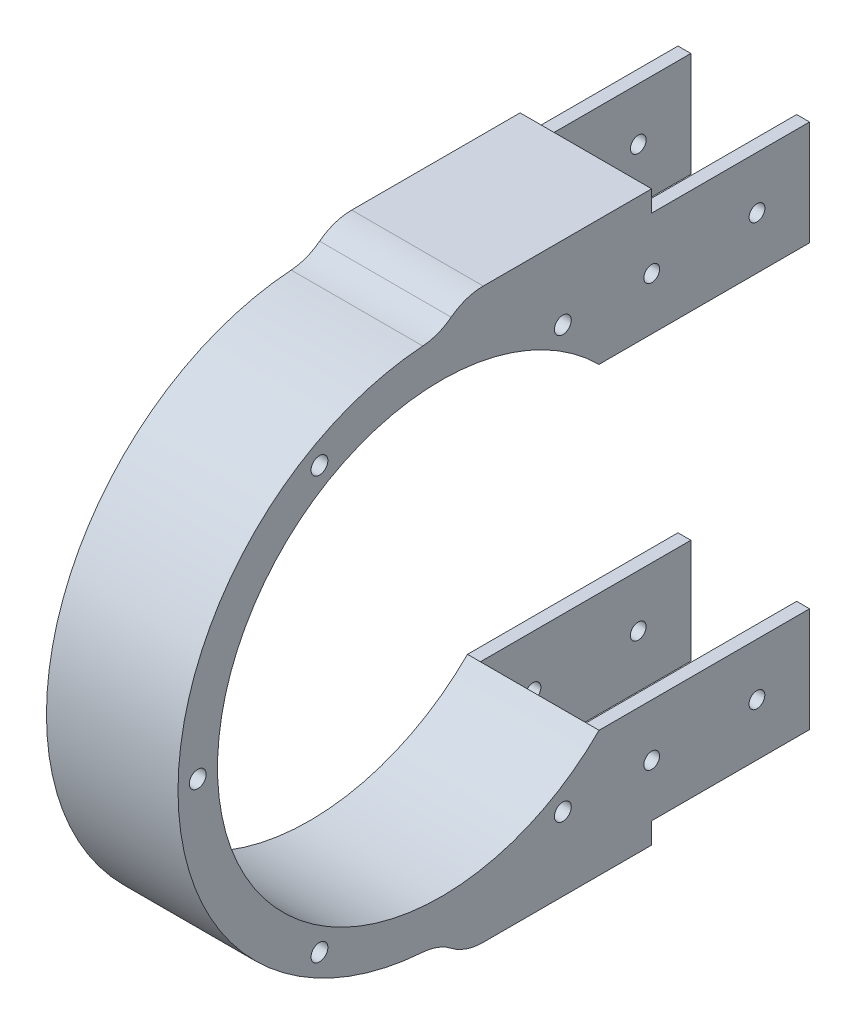
from build123d import *

# Parameters (mm, degrees)
SKETCH_1_R          = 1.6
EXTRUDE_1_DEPTH     = 25
SKETCH_2_W          = 2.45
SKETCH_2_H          = 19.896013553
EXTRUDE_2_DEPTH     = 40
SKETCH_3_R          = 1.5
CUT_EXTRUDE_1_DEPTH = 90.582364336
SKETCH_4_W          = 40
SKETCH_4_H          = 4
EXTRUDE_3_DEPTH     = 25
FILLET_4_R          = 10
FILLET_5_R          = 10


with BuildPart() as part:
    # 草图1 → 凸台-拉伸1 (new body)
    # profile 1 of 2: a face of its own
    with BuildSketch(Plane(origin=(0, 0, 0), x_dir=(0, 0, -1), z_dir=(1, 0, 0))):
        with BuildLine():
            ThreePointArc((-47.85, 0), (-46.25, 1.6), (-44.65, 0))
            Line((-44.65, 0), (-42.5, 0))
            ThreePointArc((-42.5, 0), (-16.298006013, 39.25079617), (30, 30.103986447))
            Line((30, 30.103986447), (30, 50))
            Line((30, 50), (0, 50))
            ThreePointArc((0, 50), (-35.355339059, 35.355339059), (-50, 0))
            Line((-50, 0), (-47.85, 0))
        make_face()
        with Locations((-23.125, 40.053674925)):
            Circle(SKETCH_1_R, mode=Mode.SUBTRACT)
        with Locations((23.125, 40.053674925)):
            Circle(SKETCH_1_R, mode=Mode.SUBTRACT)
    # profile 2 of 2: a face of its own
    with BuildSketch(Plane(origin=(0, 0, 0), x_dir=(0, 0, -1), z_dir=(1, 0, 0))):
        with BuildLine():
            Line((-42.5, 0), (-44.65, 0))
            ThreePointArc((-44.65, 0), (-46.25, -1.6), (-47.85, 0))
            Line((-47.85, 0), (-50, 0))
            ThreePointArc((-50, 0), (-35.355339059, -35.355339059), (0, -50))
            Line((0, -50), (30, -50))
            Line((30, -50), (30, -30.103986447))
            ThreePointArc((30, -30.103986447), (-16.298006013, -39.25079617), (-42.5, 0))
        make_face()
        with Locations((-23.125, -40.053674925)):
            Circle(SKETCH_1_R, mode=Mode.SUBTRACT)
        with Locations((23.125, -40.053674925)):
            Circle(SKETCH_1_R, mode=Mode.SUBTRACT)
    extrude(amount=EXTRUDE_1_DEPTH)

    # 草图2 → 凸台-拉伸2 (add)
    with BuildSketch(Plane(origin=(0, 0, -30), x_dir=(-1, 0, 0), z_dir=(0, 0, -1))):
        with Locations((-23.775, 40.051993223)):
            Rectangle(SKETCH_2_W, SKETCH_2_H)
        with Locations((-1.225, 40.051993223)):
            Rectangle(SKETCH_2_W, SKETCH_2_H)
        with Locations((-1.225, -40.051993223)):
            Rectangle(SKETCH_2_W, SKETCH_2_H)
        with Locations((-23.775, -40.051993223)):
            Rectangle(SKETCH_2_W, SKETCH_2_H)
    extrude(amount=EXTRUDE_2_DEPTH)

    # 草图3 → 切除-拉伸1 (cut, through all)
    with BuildSketch(Plane(origin=(25, 0, 0), x_dir=(0, 0, -1), z_dir=(1, 0, 0))):
        with Locations((60, -40.051993223)):
            Circle(SKETCH_3_R)
        with Locations((40, -40.051993223)):
            Circle(SKETCH_3_R)
        with Locations(Location((40.013969679, 40.055824631, 0), (0, 0, 270))):
            Circle(SKETCH_3_R)
        with Locations(Location((60.013968462, 40.048849193, 0), (0, 0, 270))):
            Circle(SKETCH_3_R)
    extrude(amount=-CUT_EXTRUDE_1_DEPTH, mode=Mode.SUBTRACT)

    # 草图4 → 凸台-拉伸3 (add)
    with BuildSketch(Plane(origin=(25, 0, 0), x_dir=(0, 0, -1), z_dir=(1, 0, 0))):
        with Locations((20, 52)):
            Rectangle(SKETCH_4_W, SKETCH_4_H)
        with Locations((20, -52)):
            Rectangle(SKETCH_4_W, SKETCH_4_H)
    extrude(amount=-EXTRUDE_3_DEPTH)

    # 圆角4
    # the kernel refuses this fillet: 10 mm, written as the material it takes off along each edge
    with BuildSketch(Plane(origin=(45, -54, 0), x_dir=(0, 0, -1), z_dir=(-1, 0, 0))) as fillet_4_piece_1:
        with BuildLine():
            CenterArc((8, -10), FILLET_4_R, 90, 53.130102354)
            Line((0, -4), (-0.16, -3.88))
            ThreePointArc((-0.16, -3.88), (-0.2, -2), (-0.2, 0))
            Line((-0.2, 0), (0, 0.2))
            Line((0, 0.2), (8, 0.2))
            Line((8, 0.2), (8, 0))
        make_face()
    extrude(amount=65, mode=Mode.SUBTRACT)
    with BuildSketch(Plane(origin=(45, 54, 0), x_dir=(0, 0, -1), z_dir=(-1, 0, 0))) as fillet_4_piece_2:
        with BuildLine():
            CenterArc((8, 10), FILLET_4_R, 216.869897646, 53.130102354)
            Line((0, 4), (-0.16, 3.88))
            ThreePointArc((-0.16, 3.88), (-0.2, 2), (-0.2, 0))
            Line((-0.2, 0), (0, -0.2))
            Line((0, -0.2), (8, -0.2))
            Line((8, -0.2), (8, 0))
        make_face()
    extrude(amount=65, mode=Mode.SUBTRACT)

    # 圆角5
    fillet_5_edges = [part.edges().sort_by_distance(p)[0] for p in [
        (12.5, -50, 0),
        (12.5, 50, 0),
    ]]
    fillet(fillet_5_edges, radius=FILLET_5_R)


solid = part.part
